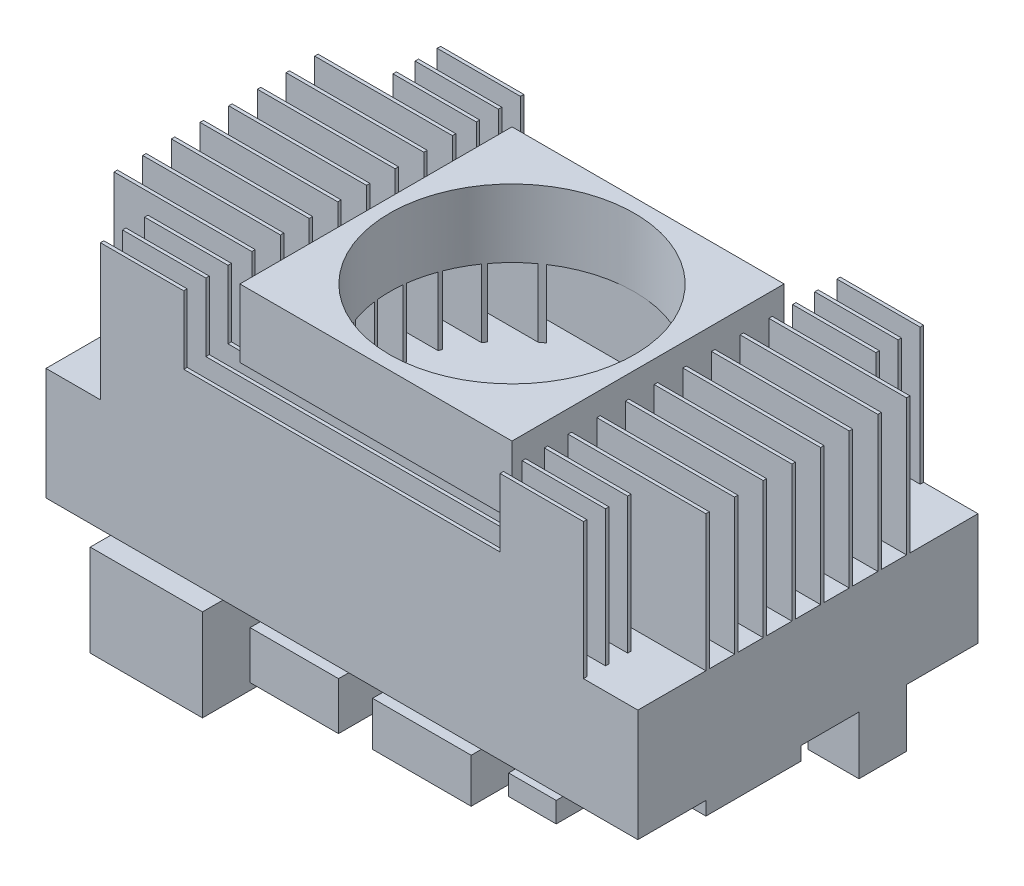
from build123d import *

# Parameters (mm, degrees)
FRONT_W                  = 87
FRONT_H                  = 52
EXTRUDE_1_DEPTH          = 50
UP_W                     = 8
UP_H                     = 8
UP_R                     = 2.5
UP_R_2                   = 18
CUT_EXTRUDE_1_DEPTH      = 20
CUT_EXTRUDE_2_DEPTH      = 104.658091821
CUT_EXTRUDE_2_DEPTH_BACK = 104.658091821
TUBES_W                  = 2.75
TUBES_H                  = 20
TUBES_W_2                = 1
TUBES_W_3                = 2
TUBES_W_4                = 3.714285714
TUBES_W_5                = 3.714285715
UP_3_W                   = 46.5
UP_3_H                   = 50
UP_3_W_2                 = 40
UP_3_H_2                 = 40
CUT_EXTRUDE_3_DEPTH      = 10
UP_4_W                   = 40
UP_4_H                   = 40
UP_4_R                   = 18
EXTRUDE_2_DEPTH          = 10
INTERFACES_W             = 87
INTERFACES_H             = 15.5
CUT_EXTRUDE_4_DEPTH      = 72.191642768
EXTRUDE_3_DEPTH          = 3
EXTRUDE_3_DEPTH_BACK     = 30
INTERFACES_3_W           = 16.5
INTERFACES_3_H           = 13.5
EXTRUDE_4_DEPTH          = 1.5
EXTRUDE_4_DEPTH_BACK     = 15
INTERFACES_4_W           = 13
INTERFACES_4_H           = 7
EXTRUDE_5_DEPTH          = 1.5
EXTRUDE_5_DEPTH_BACK     = 9.5
INTERFACES_5_W           = 14.5
INTERFACES_5_H           = 6.5
EXTRUDE_6_DEPTH          = 1
EXTRUDE_6_DEPTH_BACK     = 3.5
INTERFACES_6_W           = 7
INTERFACES_6_H           = 3
KEYS_AND_SDCARD_W        = 15
KEYS_AND_SDCARD_H        = 14
EXTRUDE_7_DEPTH          = 2
EXTRUDE_START            = 36
EXTRUDE_8_OUTLINE_W      = 8.5
EXTRUDE_8_OUTLINE_H      = 7
EXTRUDE_8_DEPTH          = 7.5
EXTRUDE_START_2          = -41.5
EXTRUDE_8_2_OUTLINE_W    = 8.5
EXTRUDE_8_2_OUTLINE_H    = 0.5
EXTRUDE_8_2_DEPTH        = 0.5
EXTRUDE_START_3          = -39
EXTRUDE_8_3_OUTLINE_W    = 8.5
EXTRUDE_8_3_OUTLINE_H    = 0.5
EXTRUDE_8_3_DEPTH        = 0.5
KEYS_AND_SDCARD_4_W      = 4
KEYS_AND_SDCARD_4_H      = 2.5
EXTRUDE_9_DEPTH          = 1.5
EXTRUDE_10_DEPTH         = 2


# Read off the part's stored shape, not the designer's step: 凸台-拉伸8
with BuildPart() as part:
    # Front → 凸台-拉伸1 (new body)
    with BuildSketch(Plane.XY):
        Rectangle(FRONT_W, FRONT_H)
    extrude(amount=-EXTRUDE_1_DEPTH)

    # Up → 切除-拉伸1 (cut)
    # profile 1 of 9: a face of its own
    with BuildSketch(Plane(origin=(0, 26, 0), x_dir=(1, 0, 0), z_dir=(0, 1, 0))):
        with Locations((-39.5, 46)):
            Rectangle(UP_W, UP_H)
        with Locations((-39.5, 46)):
            Circle(UP_R, mode=Mode.SUBTRACT)
    # profile 2 of 9: a face of its own
    with BuildSketch(Plane(origin=(0, 26, 0), x_dir=(1, 0, 0), z_dir=(0, 1, 0))):
        with Locations((-39.5, 46)):
            Circle(UP_R)
    # profile 3 of 9: a face of its own
    with BuildSketch(Plane(origin=(0, 26, 0), x_dir=(1, 0, 0), z_dir=(0, 1, 0))):
        with Locations((-39.5, 4)):
            Rectangle(UP_W, UP_H)
        with Locations((-39.5, 4)):
            Circle(UP_R, mode=Mode.SUBTRACT)
    # profile 4 of 9: a face of its own
    with BuildSketch(Plane(origin=(0, 26, 0), x_dir=(1, 0, 0), z_dir=(0, 1, 0))):
        with Locations((-39.5, 4)):
            Circle(UP_R)
    # profile 5 of 9: a face of its own
    with BuildSketch(Plane(origin=(0, 26, 0), x_dir=(1, 0, 0), z_dir=(0, 1, 0))):
        with Locations((39.5, 4)):
            Rectangle(UP_W, UP_H)
        with Locations((39.5, 4)):
            Circle(UP_R, mode=Mode.SUBTRACT)
    # profile 6 of 9: a face of its own
    with BuildSketch(Plane(origin=(0, 26, 0), x_dir=(1, 0, 0), z_dir=(0, 1, 0))):
        with Locations((39.5, 4)):
            Circle(UP_R)
    # profile 7 of 9: a face of its own
    with BuildSketch(Plane(origin=(0, 26, 0), x_dir=(1, 0, 0), z_dir=(0, 1, 0))):
        with Locations(Location((0, 25, 0), (0, 0, 270))):
            Circle(UP_R_2)
    # profile 8 of 9: a face of its own
    with BuildSketch(Plane(origin=(0, 26, 0), x_dir=(1, 0, 0), z_dir=(0, 1, 0))):
        with Locations((39.5, 46)):
            Rectangle(UP_W, UP_H)
        with Locations((39.5, 46)):
            Circle(UP_R, mode=Mode.SUBTRACT)
    # profile 9 of 9: a face of its own
    with BuildSketch(Plane(origin=(0, 26, 0), x_dir=(1, 0, 0), z_dir=(0, 1, 0))):
        with Locations((39.5, 46)):
            Circle(UP_R)
    extrude(amount=-CUT_EXTRUDE_1_DEPTH, mode=Mode.SUBTRACT)

    # Tubes → 切除-拉伸2 (cut, two sides: drawn at the far end of the back side and taken through both)
    with BuildSketch(Plane.ZY.offset(43.5).offset(-CUT_EXTRUDE_2_DEPTH_BACK)):
        with Locations((-48.125, 16)):
            Rectangle(TUBES_W, TUBES_H)
        with Locations((-44.875, 16)):
            Rectangle(TUBES_W, TUBES_H)
        with Locations((-42.5, 16)):
            Rectangle(TUBES_W_2, TUBES_H)
        with Locations((-41, 16)):
            Rectangle(TUBES_W_3, TUBES_H)
        with Locations((-37.642857143, 16)):
            Rectangle(TUBES_W_4, TUBES_H)
        with Locations((-33.428571428, 16)):
            Rectangle(TUBES_W_5, TUBES_H)
        with Locations((-29.214285714, 16)):
            Rectangle(TUBES_W_4, TUBES_H)
        with Locations((-25, 16)):
            Rectangle(TUBES_W_4, TUBES_H)
        with Locations((-20.785714286, 16)):
            Rectangle(TUBES_W_4, TUBES_H)
        with Locations((-16.571428572, 16)):
            Rectangle(TUBES_W_5, TUBES_H)
        with Locations((-12.357142857, 16)):
            Rectangle(TUBES_W_4, TUBES_H)
        with Locations((-9, 16)):
            Rectangle(TUBES_W_3, TUBES_H)
        with Locations((-7.5, 16)):
            Rectangle(TUBES_W_2, TUBES_H)
        with Locations((-5.125, 16)):
            Rectangle(TUBES_W, TUBES_H)
        with Locations((-1.875, 16)):
            Rectangle(TUBES_W, TUBES_H)
    extrude(amount=CUT_EXTRUDE_2_DEPTH + CUT_EXTRUDE_2_DEPTH_BACK, mode=Mode.SUBTRACT)

    # Up<3> → 切除-拉伸3 (cut)
    with BuildSketch(Plane(origin=(0, 26, 0), x_dir=(1, 0, 0), z_dir=(0, 1, 0))):
        with Locations((0, 25)):
            Rectangle(UP_3_W, UP_3_H)
        with Locations((0, 25)):
            Rectangle(UP_3_W_2, UP_3_H_2, mode=Mode.SUBTRACT)
    extrude(amount=-CUT_EXTRUDE_3_DEPTH, mode=Mode.SUBTRACT)

    # Up<4> → 凸台-拉伸2 (add)
    with BuildSketch(Plane(origin=(0, 26, 0), x_dir=(1, 0, 0), z_dir=(0, 1, 0))):
        with Locations((0, 25)):
            Rectangle(UP_4_W, UP_4_H)
        with Locations(Location((0, 25, 0), (0, 0, 270))):
            Circle(UP_4_R, mode=Mode.SUBTRACT)
    extrude(amount=-EXTRUDE_2_DEPTH)

    # Interfaces → 切除-拉伸4 (cut, through all)
    with BuildSketch(Plane.XY):
        with Locations((0, -18.25)):
            Rectangle(INTERFACES_W, INTERFACES_H)
    extrude(amount=-CUT_EXTRUDE_4_DEPTH, mode=Mode.SUBTRACT)

    # Interfaces<3> → 凸台-拉伸3 (add, two sides: drawn at the far end of the back side and taken through both)
    with BuildSketch(Plane.XY.offset(-EXTRUDE_3_DEPTH_BACK)):
        with Locations((-25.75, -17.25)):
            Rectangle(INTERFACES_3_W, INTERFACES_3_H)
    extrude(amount=EXTRUDE_3_DEPTH + EXTRUDE_3_DEPTH_BACK)

    # Interfaces<4> → 凸台-拉伸4 (add, two sides: drawn at the far end of the back side and taken through both)
    with BuildSketch(Plane.XY.offset(-EXTRUDE_4_DEPTH_BACK)):
        with Locations((-5.5, -14)):
            Rectangle(INTERFACES_4_W, INTERFACES_4_H)
    extrude(amount=EXTRUDE_4_DEPTH + EXTRUDE_4_DEPTH_BACK)

    # Interfaces<5> → 凸台-拉伸5 (add, two sides: drawn at the far end of the back side and taken through both)
    with BuildSketch(Plane.XY.offset(-EXTRUDE_5_DEPTH_BACK)):
        with Locations((13.25, -13.75)):
            Rectangle(INTERFACES_5_W, INTERFACES_5_H)
    extrude(amount=EXTRUDE_5_DEPTH + EXTRUDE_5_DEPTH_BACK)

    # Interfaces<6> → 凸台-拉伸6 (add, two sides: drawn at the far end of the back side and taken through both)
    with BuildSketch(Plane.XY.offset(-EXTRUDE_6_DEPTH_BACK)):
        with Locations((29, -12)):
            Rectangle(INTERFACES_6_W, INTERFACES_6_H)
    extrude(amount=EXTRUDE_6_DEPTH + EXTRUDE_6_DEPTH_BACK)

    # keys_and_sdcard → 凸台-拉伸7 (add)
    with BuildSketch(Plane.XZ.offset(10.5)):
        with Locations((36, -17)):
            Rectangle(KEYS_AND_SDCARD_W, KEYS_AND_SDCARD_H)
    extrude(amount=EXTRUDE_7_DEPTH)

    # 凸台-拉伸8 outline → 凸台-拉伸8 (add)
    with BuildSketch(Plane.YZ.offset(EXTRUDE_START)):
        with Locations((-14.75, -36)):
            Rectangle(EXTRUDE_8_OUTLINE_W, EXTRUDE_8_OUTLINE_H)
    extrude(amount=EXTRUDE_8_DEPTH)

    # Extrude 8 2 outline → Extrude 8 2 (add)
    with BuildSketch(Plane.YZ.offset(EXTRUDE_START_2)):
        with Locations((-14.75, -9.25)):
            Rectangle(EXTRUDE_8_2_OUTLINE_W, EXTRUDE_8_2_OUTLINE_H)
        with Locations((-14.75, -31.75)):
            Rectangle(EXTRUDE_8_2_OUTLINE_W, EXTRUDE_8_2_OUTLINE_H)
        with Locations((-14.75, -29.25)):
            Rectangle(EXTRUDE_8_2_OUTLINE_W, EXTRUDE_8_2_OUTLINE_H)
        with Locations((-14.75, -26.75)):
            Rectangle(EXTRUDE_8_2_OUTLINE_W, EXTRUDE_8_2_OUTLINE_H)
        with Locations((-14.75, -24.25)):
            Rectangle(EXTRUDE_8_2_OUTLINE_W, EXTRUDE_8_2_OUTLINE_H)
        with Locations((-14.75, -21.75)):
            Rectangle(EXTRUDE_8_2_OUTLINE_W, EXTRUDE_8_2_OUTLINE_H)
        with Locations((-14.75, -19.25)):
            Rectangle(EXTRUDE_8_2_OUTLINE_W, EXTRUDE_8_2_OUTLINE_H)
        with Locations((-14.75, -16.75)):
            Rectangle(EXTRUDE_8_2_OUTLINE_W, EXTRUDE_8_2_OUTLINE_H)
        with Locations((-14.75, -14.25)):
            Rectangle(EXTRUDE_8_2_OUTLINE_W, EXTRUDE_8_2_OUTLINE_H)
        with Locations((-14.75, -11.75)):
            Rectangle(EXTRUDE_8_2_OUTLINE_W, EXTRUDE_8_2_OUTLINE_H)
    extrude(amount=EXTRUDE_8_2_DEPTH)

    # Extrude 8 3 outline → Extrude 8 3 (add)
    with BuildSketch(Plane.YZ.offset(EXTRUDE_START_3)):
        with Locations((-14.75, -9.25)):
            Rectangle(EXTRUDE_8_3_OUTLINE_W, EXTRUDE_8_3_OUTLINE_H)
        with Locations((-14.75, -31.75)):
            Rectangle(EXTRUDE_8_3_OUTLINE_W, EXTRUDE_8_3_OUTLINE_H)
        with Locations((-14.75, -29.25)):
            Rectangle(EXTRUDE_8_3_OUTLINE_W, EXTRUDE_8_3_OUTLINE_H)
        with Locations((-14.75, -26.75)):
            Rectangle(EXTRUDE_8_3_OUTLINE_W, EXTRUDE_8_3_OUTLINE_H)
        with Locations((-14.75, -24.25)):
            Rectangle(EXTRUDE_8_3_OUTLINE_W, EXTRUDE_8_3_OUTLINE_H)
        with Locations((-14.75, -21.75)):
            Rectangle(EXTRUDE_8_3_OUTLINE_W, EXTRUDE_8_3_OUTLINE_H)
        with Locations((-14.75, -19.25)):
            Rectangle(EXTRUDE_8_3_OUTLINE_W, EXTRUDE_8_3_OUTLINE_H)
        with Locations((-14.75, -16.75)):
            Rectangle(EXTRUDE_8_3_OUTLINE_W, EXTRUDE_8_3_OUTLINE_H)
        with Locations((-14.75, -14.25)):
            Rectangle(EXTRUDE_8_3_OUTLINE_W, EXTRUDE_8_3_OUTLINE_H)
        with Locations((-14.75, -11.75)):
            Rectangle(EXTRUDE_8_3_OUTLINE_W, EXTRUDE_8_3_OUTLINE_H)
    extrude(amount=EXTRUDE_8_3_DEPTH)

    # keys_and_sdcard<4> → 凸台-拉伸9 (add)
    # profile 1 of 3: a face of its own
    with BuildSketch(Plane.XZ.offset(10.5)):
        with Locations((-6.5, -47.25)):
            Rectangle(KEYS_AND_SDCARD_4_W, KEYS_AND_SDCARD_4_H)
        with BuildLine():
            ThreePointArc((-5.5, -48), (-4.75, -47.25), (-5.5, -46.5))
            Line((-5.5, -46.5), (-7.5, -46.5))
            ThreePointArc((-7.5, -46.5), (-8.25, -47.25), (-7.5, -48))
            Line((-7.5, -48), (-5.5, -48))
        make_face(mode=Mode.SUBTRACT)
    # profile 2 of 3: a face of its own
    with BuildSketch(Plane.XZ.offset(10.5)):
        with Locations((1.5, -47.25)):
            Rectangle(KEYS_AND_SDCARD_4_W, KEYS_AND_SDCARD_4_H)
        with BuildLine():
            ThreePointArc((2.5, -48), (3.25, -47.25), (2.5, -46.5))
            Line((2.5, -46.5), (0.5, -46.5))
            ThreePointArc((0.5, -46.5), (-0.25, -47.25), (0.5, -48))
            Line((0.5, -48), (2.5, -48))
        make_face(mode=Mode.SUBTRACT)
    # profile 3 of 3: a face of its own
    with BuildSketch(Plane.XZ.offset(10.5)):
        with Locations((9.5, -47.25)):
            Rectangle(KEYS_AND_SDCARD_4_W, KEYS_AND_SDCARD_4_H)
        with BuildLine():
            ThreePointArc((10.5, -48), (11.25, -47.25), (10.5, -46.5))
            Line((10.5, -46.5), (8.5, -46.5))
            ThreePointArc((8.5, -46.5), (7.75, -47.25), (8.5, -48))
            Line((8.5, -48), (10.5, -48))
        make_face(mode=Mode.SUBTRACT)
    extrude(amount=EXTRUDE_9_DEPTH)

    # keys_and_sdcard<5> → 凸台-拉伸10 (add)
    with BuildSketch(Plane.XZ.offset(10.5)):
        with BuildLine():
            Line((-7.5, -46.5), (-5.5, -46.5))
            ThreePointArc((-5.5, -46.5), (-4.75, -47.25), (-5.5, -48))
            Line((-5.5, -48), (-7.5, -48))
            ThreePointArc((-7.5, -48), (-8.25, -47.25), (-7.5, -46.5))
        make_face()
        with BuildLine():
            Line((0.5, -46.5), (2.5, -46.5))
            ThreePointArc((2.5, -46.5), (3.25, -47.25), (2.5, -48))
            Line((2.5, -48), (0.5, -48))
            ThreePointArc((0.5, -48), (-0.25, -47.25), (0.5, -46.5))
        make_face()
        with BuildLine():
            Line((8.5, -46.5), (10.5, -46.5))
            ThreePointArc((10.5, -46.5), (11.25, -47.25), (10.5, -48))
            Line((10.5, -48), (8.5, -48))
            ThreePointArc((8.5, -48), (7.75, -47.25), (8.5, -46.5))
        make_face()
    extrude(amount=EXTRUDE_10_DEPTH)


solid = part.part
